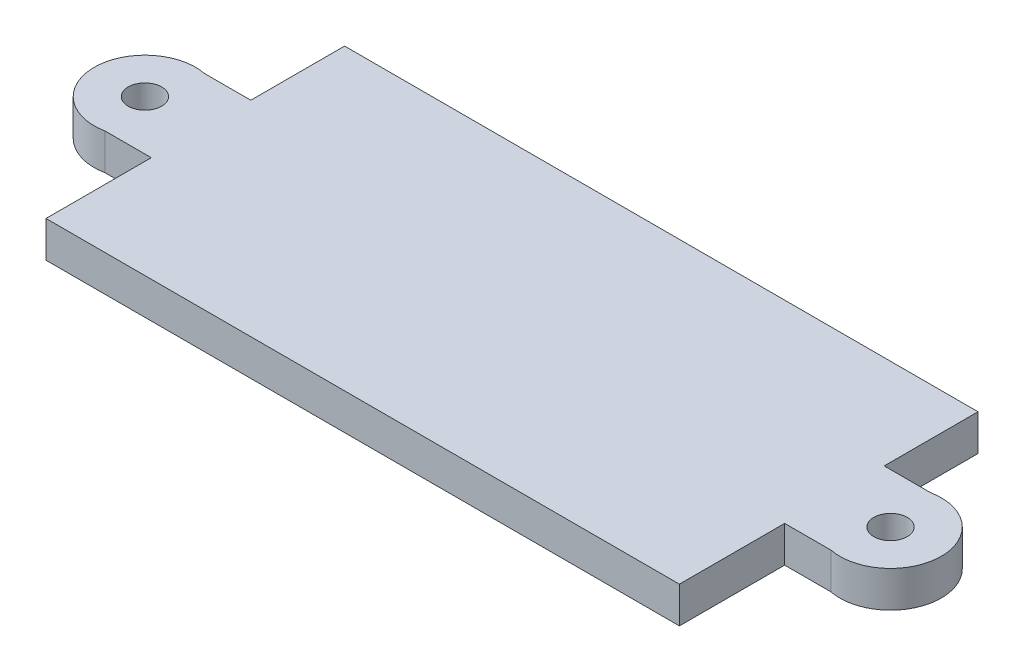
from build123d import *

# Parameters (mm, degrees)
BOSS_EXTRUDE1_DEPTH = 5.08
CUT_EXTRUDE1_REACH  = 93.131
SKETCH2_R           = 2.3495


with BuildPart() as part:
    # Sketch1 → Boss-Extrude1 (new body)
    with BuildSketch(Plane(origin=(0, 0, 0), x_dir=(1, 0, 0), z_dir=(0, 1, 0))):
        with BuildLine():
            Line((-70.953364113, -15.091902455), (-70.953364113, -29.866027969))
            Line((-70.953364113, -29.866027969), (-26.503364113, -29.866027969))
            Line((-26.503364113, -29.866027969), (-26.503364113, 12.043972031))
            Line((-26.503364113, 12.043972031), (-70.953364113, 12.043972031))
            Line((-70.953364113, 12.043972031), (-70.953364113, -1.121902455))
            Line((-70.953364113, -1.121902455), (-77.441755774, -1.121902455))
            ThreePointArc((-77.441755774, -1.121902455), (-85.948469046, -8.106902455), (-77.441755774, -15.091902455))
            Line((-77.441755774, -15.091902455), (-70.953364113, -15.091902455))
        make_face()
    boss_extrude1 = extrude(amount=BOSS_EXTRUDE1_DEPTH)

    # Sketch2 → Cut-Extrude1 (cut, up to next)
    with BuildSketch(Plane(origin=(0, 0, 0), x_dir=(-1, 0, 0), z_dir=(0, -1, 0)), mode=Mode.PRIVATE) as cut_extrude1_sk1:
        with Locations((78.827364113, -8.106902455)):
            Circle(SKETCH2_R)
    cut_extrude1_tool1 = extrude(cut_extrude1_sk1.sketch, amount=-CUT_EXTRUDE1_REACH, mode=Mode.PRIVATE) & part.part
    cut_extrude1 = cut_extrude1_tool1.solids().sort_by_distance((-78.827364, 0, 8.106902))[0]
    add(cut_extrude1, mode=Mode.SUBTRACT)

    # Mirror2: Boss-Extrude1, Cut-Extrude1 across plane
    add(boss_extrude1.mirror(Plane(origin=(-26.503364113, 5.08, 0), x_dir=(0, 0, 1), z_dir=(-1, 0, 0))))
    add(cut_extrude1.mirror(Plane(origin=(-26.503364113, 5.08, 0), x_dir=(0, 0, 1), z_dir=(-1, 0, 0))), mode=Mode.SUBTRACT)


solid = part.part
